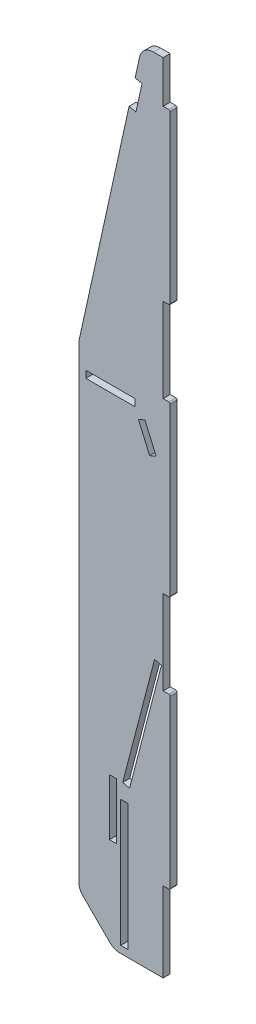
from build123d import *

# Parameters (mm, degrees)
BOSS_EXTRUDE1_DEPTH = 5
SKETCH2_W           = 5
SKETCH2_H           = 90
SKETCH2_H_2         = 40
SKETCH2_W_2         = 35
SKETCH2_H_3         = 5
CUT_EXTRUDE1_DEPTH  = 10
CUT_EXTRUDE2_DEPTH  = 10
FILLET1_R           = 1
FILLET2_R           = 10
CUT_EXTRUDE3_DEPTH  = 10


with BuildPart() as part:
    # Sketch1 → Boss-Extrude1 (new body)
    with BuildSketch(Plane.XY):
        Polygon((80, 33.22), (20, 33.22), (20, 600), (80, 600), (80, 570.05), (85, 570.05), (85, 449.95), (80, 449.95), (80, 390.05), (85, 390.05), (85, 269.95), (80, 269.95), (80, 210.05), (85, 210.05), (85, 89.95), (80, 89.95), align=None)
    extrude(amount=BOSS_EXTRUDE1_DEPTH)

    # Sketch2 → Cut-Extrude1 (cut)
    with BuildSketch(Plane.XY.offset(5)):
        Polygon((67, 370.417424305), (62.417424305, 368.417424305), (70.417424305, 350.087121525), (75, 352.087121525), align=None)
        Polygon((73.902811841, 226.418897298), (51.258042728, 139.314279557), (56.097188159, 138.056236829), (78.741957272, 225.16085457), align=None)
        with Locations((52.33914543, 83.217091399)):
            Rectangle(SKETCH2_W, SKETCH2_H)
        with Locations((44.33914543, 119.314279557)):
            Rectangle(SKETCH2_W, SKETCH2_H_2)
        with Locations((42.5, 377.5)):
            Rectangle(SKETCH2_W_2, SKETCH2_H_3)
    extrude(amount=-CUT_EXTRUDE1_DEPTH, mode=Mode.SUBTRACT)

    # Sketch3 → Cut-Extrude2 (cut)
    with BuildSketch(Plane.XY.offset(5)):
        Polygon((20, 395), (65, 600), (1.513631165, 616.08755832), align=None)
        Polygon((45, 33.22), (20, 58.22), (13.452472792, 20.556075169), align=None)
    extrude(amount=-CUT_EXTRUDE2_DEPTH, mode=Mode.SUBTRACT)

    # Fillet1
    fillet1_edges = [part.edges().sort_by_distance(p)[0] for p in [
        (85, 570.05, 2.5),
        (85, 449.95, 2.5),
        (85, 390.05, 2.5),
        (85, 269.95, 2.5),
        (85, 210.05, 2.5),
        (85, 89.95, 2.5),
    ]]
    fillet(fillet1_edges, radius=FILLET1_R)

    # Fillet2
    fillet2_edges = [part.edges().sort_by_distance(p)[0] for p in [
        (65, 600, 2.5),
        (20, 395, 2.5),
        (20, 58.22, 2.5),
        (45, 33.22, 2.5),
    ]]
    fillet(fillet2_edges, radius=FILLET2_R)

    # Sketch4 → Cut-Extrude3 (cut)
    with BuildSketch(Plane.XY.offset(5)):
        Polygon((60.059418786, 577.492907801), (64.943140501, 576.420871327), (60.654994605, 556.885984463), (55.771272889, 557.958020937), align=None)
    extrude(amount=-CUT_EXTRUDE3_DEPTH, mode=Mode.SUBTRACT)


solid = part.part
